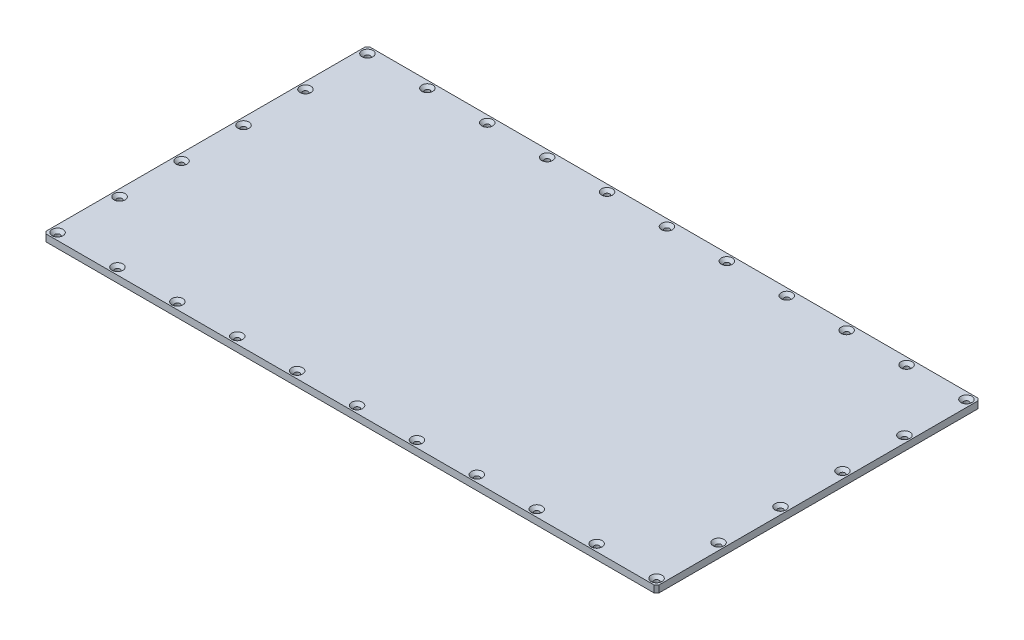
from build123d import *
from build123d.topology import SkipClean

# Parameters (mm, degrees)
SKETCH1_R           = 2.25
BOSS_EXTRUDE1_DEPTH = 6
CHAMFER1_SIZE       = 2.5
CHAMFER2_SIZE       = 2


with BuildPart() as part:
    # Sketch1 → Boss-Extrude1 (new body)
    with BuildSketch(Plane(origin=(0, 0, 0), x_dir=(1, 0, 0), z_dir=(0, 1, 0))):
        with BuildLine():
            Line((265, -131.75), (265, 0))
            Line((265, 0), (0, 0))
            Line((0, 0), (0, -140))
            Line((0, -140), (265, -140))
            Line((265, -140), (265, -136.25))
            ThreePointArc((265, -136.25), (262.75, -134), (265, -131.75))
        make_face()
        with Locations((6, -26.8)):
            Circle(SKETCH1_R, mode=Mode.SUBTRACT)
        with Locations((6, -80.4)):
            Circle(SKETCH1_R, mode=Mode.SUBTRACT)
        with Locations((6, -134)):
            Circle(SKETCH1_R, mode=Mode.SUBTRACT)
        with Locations((57.8, -134)):
            Circle(SKETCH1_R, mode=Mode.SUBTRACT)
        with Locations((109.6, -134)):
            Circle(SKETCH1_R, mode=Mode.SUBTRACT)
        with Locations((161.4, -134)):
            Circle(SKETCH1_R, mode=Mode.SUBTRACT)
        with Locations((213.2, -134)):
            Circle(SKETCH1_R, mode=Mode.SUBTRACT)
    extrude(amount=BOSS_EXTRUDE1_DEPTH)

    # Chamfer1
    chamfer1_edges = [part.edges().sort_by_distance(p)[0] for p in [
        (3.75, 6, 26.8),
        (3.75, 6, 80.4),
        (3.75, 6, 134),
        (55.55, 6, 134),
        (107.35, 6, 134),
        (159.15, 6, 134),
        (210.95, 6, 134),
        (262.75, 6, 134),
    ]]
    chamfer(chamfer1_edges, length=CHAMFER1_SIZE)

    # Mirror3: part across plane


with BuildPart() as part_1:
    with SkipClean():  # the faces are left unmerged after this step: merging them gives an invalid solid
        add(part.part)
        add(part.part.mirror(Plane(origin=(265, 6, 131.75), x_dir=(0, 0, 1), z_dir=(-1, 0, 0))))

    # Mirror4: part across plane


with BuildPart() as part_2:
    with SkipClean():  # the faces are left unmerged after this step: merging them gives an invalid solid
        add(part_1.part)
        add(part_1.part.mirror(Plane(origin=(0, 6, 0), x_dir=(1, 0, 0), z_dir=(0, 0, -1))))

    # Chamfer2
    chamfer2_edges = [part_2.edges().sort_by_distance(p)[0] for p in [
        (0, 3, -140),
        (0, 3, 140),
        (530, 3, -140),
        (530, 3, 140),
    ]]
    chamfer(chamfer2_edges, length=CHAMFER2_SIZE)


solid = part_2.part
